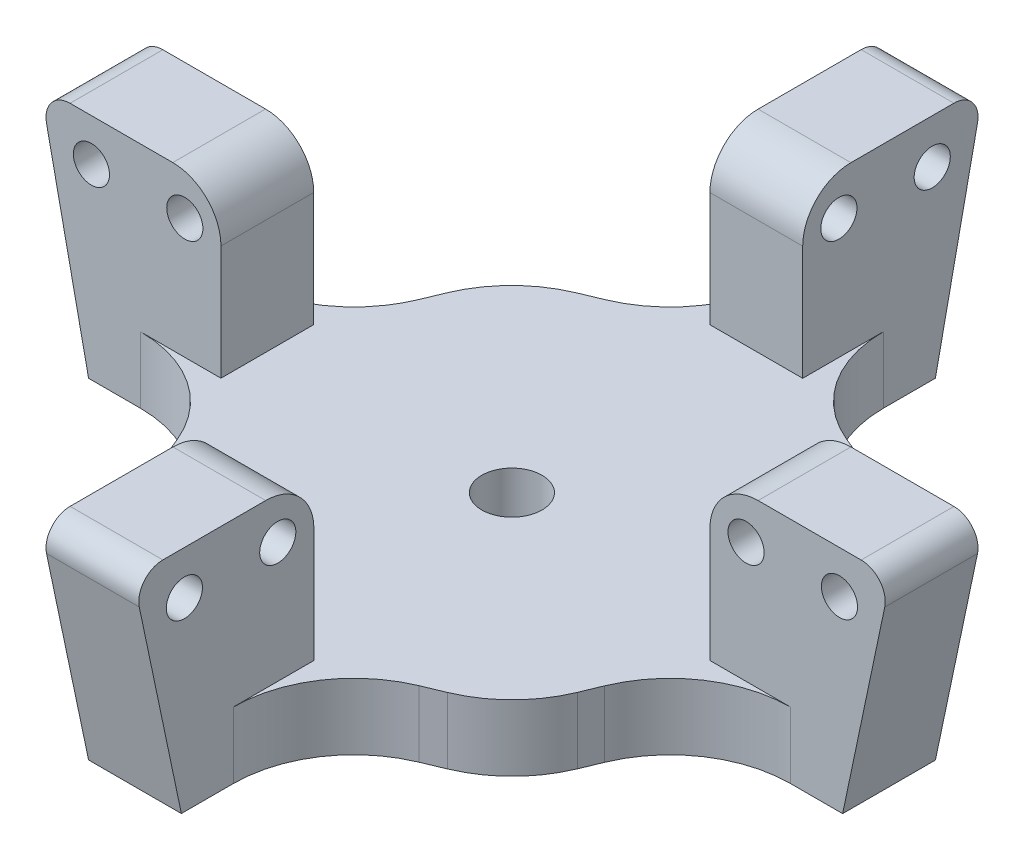
from build123d import *

# Parameters (mm, degrees)
BOSS_EXTRUSION_DEPTH     = 5.5
SCHIZZO2_W               = 14.985516936
SCHIZZO2_H               = 7.7
SCHIZZO2_W_2             = 7.7
SCHIZZO2_H_2             = 15.014483064
SCHIZZO2_W_3             = 15.014483064
SCHIZZO2_H_3             = 15
EXTERNAL_EXTRUSION_DEPTH = 13.5
SCHIZZO3_R               = 2.5
CETRAL_HOLE_DEPTH        = 52.71287379
TAGLIO_ESTRUSIONE2_DEPTH = 57.032066134
TAGLIO_ESTRUSIONE3_DEPTH = 57.021948056
TAGLIO_ESTRUSIONE4_DEPTH = 57.021948056
TAGLIO_ESTRUSIONE5_DEPTH = 57.032066134
FORO_PER_VITE_M4_1_D     = 3
FORO_PER_VITE_M4_2_D     = 3
FORO_PER_VITE_M4_3_D     = 3
FORO_PER_VITE_M4_4_D     = 3
RACCORDO1_R              = 4
RACCORDO2_R              = 4
RACCORDO3_R              = 4
RACCORDO4_R              = 4
RACCORDO5_R              = 2
RACCORDO6_R              = 2
RACCORDO7_R              = 2
RACCORDO8_R              = 2
RACCORDO9_R              = 10
RACCORDO17_R             = 10
RACCORDO18_R             = 10
RACCORDO19_R             = 10
RACCORDO20_R             = 10
RACCORDO21_R             = 10
RACCORDO22_DEPTH         = 5.5
RACCORDO23_R             = 10
RACCORDO24_R             = 10
RACCORDO25_R             = 10


with BuildPart() as part:
    # Schizzo1 → Boss extrusion (new body)
    with BuildSketch(Plane(origin=(0, 0, 0), x_dir=(1, 0, 0), z_dir=(0, 1, 0))):
        Polygon((-3.85, -20.28403897), (-3.85, -35.28403897), (3.85, -35.28403897), (3.85, -20.298522034), (15.500302101, -15.451094793), (20.28403897, -3.85), (35.298522034, -3.85), (35.298522034, 3.85), (20.298522034, 3.85), (15.451094793, 15.500302101), (3.85, 20.28403897), (3.85, 35.298522034), (-3.85, 35.298522034), (-3.85, 20.298522034), (-15.500302101, 15.451094793), (-20.28403897, 3.85), (-35.28403897, 3.85), (-35.28403897, -3.85), (-20.298522034, -3.85), (-15.451094793, -15.500302101), align=None)
    extrude(amount=BOSS_EXTRUSION_DEPTH)

    # Schizzo2 → external extrusion (add)
    with BuildSketch(Plane(origin=(0, 5.5, 0), x_dir=(1, 0, 0), z_dir=(0, 1, 0))):
        with Locations((-27.791280502, 0)):
            Rectangle(SCHIZZO2_W, SCHIZZO2_H)
        with Locations((0, 27.791280502)):
            Rectangle(SCHIZZO2_W_2, SCHIZZO2_H_2)
        with Locations((27.791280502, 0)):
            Rectangle(SCHIZZO2_W_3, SCHIZZO2_H)
        with Locations((0, -27.78403897)):
            Rectangle(SCHIZZO2_W_2, SCHIZZO2_H_3)
    extrude(amount=EXTERNAL_EXTRUSION_DEPTH)

    # Schizzo3 → cetral hole (cut, through all)
    with BuildSketch(Plane(origin=(0, 5.5, 0), x_dir=(1, 0, 0), z_dir=(0, 1, 0))):
        with Locations(Location((0, 0, 0), (0, 0, 270))):
            Circle(SCHIZZO3_R)
    extrude(amount=-CETRAL_HOLE_DEPTH, mode=Mode.SUBTRACT)

    # Schizzo4 → Taglio-Estrusione2 (cut, through all)
    with BuildSketch(Plane.XY.offset(3.85)):
        Polygon((35.298522034, 0), (35.298522034, 19), (31.298522034, 0), align=None)
    extrude(amount=-TAGLIO_ESTRUSIONE2_DEPTH, mode=Mode.SUBTRACT)

    # Schizzo5 → Taglio-Estrusione3 (cut, through all)
    with BuildSketch(Plane(origin=(3.85, 0, 0), x_dir=(0, 0, -1), z_dir=(1, 0, 0))):
        Polygon((35.298522034, 0), (35.298522034, 19), (31.298522034, 0), align=None)
    extrude(amount=-TAGLIO_ESTRUSIONE3_DEPTH, mode=Mode.SUBTRACT)

    # Schizzo8 → Taglio-Estrusione4 (cut, through all)
    with BuildSketch(Plane(origin=(0, 0, -3.85), x_dir=(-1, 0, 0), z_dir=(0, 0, -1))):
        Polygon((35.28403897, 0), (35.28403897, 19), (31.28403897, 0), align=None)
    extrude(amount=-TAGLIO_ESTRUSIONE4_DEPTH, mode=Mode.SUBTRACT)

    # Schizzo9 → Taglio-Estrusione5 (cut, through all)
    with BuildSketch(Plane.ZY.offset(3.85)):
        Polygon((35.28403897, 0), (35.28403897, 19), (31.28403897, 0), align=None)
    extrude(amount=-TAGLIO_ESTRUSIONE5_DEPTH, mode=Mode.SUBTRACT)

    # Foro per Vite M4-1 (through all)
    with Locations(Plane.ZY.offset(3.85)):
        with Locations((23.28403897, 15.5), (31.03403897, 15.381977535)):
            Hole(FORO_PER_VITE_M4_1_D / 2)

    # Foro per Vite M4-2 (through all)
    with Locations(Plane.XY.offset(3.85)):
        with Locations((23.28403897, 15.5), (31.03403897, 15.469257355)):
            Hole(FORO_PER_VITE_M4_2_D / 2)

    # Foro per Vite M4-3 (through all)
    with Locations(Plane(origin=(3.85, 0, 0), x_dir=(0, 0, -1), z_dir=(1, 0, 0))):
        with Locations((23.28403897, 15.5), (31.03403897, 15.315212004)):
            Hole(FORO_PER_VITE_M4_3_D / 2)

    # Foro per Vite M4-4 (through all)
    with Locations(Plane(origin=(0, 0, -3.85), x_dir=(-1, 0, 0), z_dir=(0, 0, -1))):
        with Locations((23.298522034, 15.5), (31.048522034, 15.5)):
            Hole(FORO_PER_VITE_M4_4_D / 2)

    # Raccordo1
    raccordo1_edges = [part.edges().sort_by_distance(p)[0] for p in [
        (20.28403897, 19, 0),
    ]]
    fillet(raccordo1_edges, radius=RACCORDO1_R)

    # Raccordo2
    raccordo2_edges = [part.edges().sort_by_distance(p)[0] for p in [
        (0, 19, -20.28403897),
    ]]
    fillet(raccordo2_edges, radius=RACCORDO2_R)

    # Raccordo3
    raccordo3_edges = [part.edges().sort_by_distance(p)[0] for p in [
        (-20.298522034, 19, 0),
    ]]
    fillet(raccordo3_edges, radius=RACCORDO3_R)

    # Raccordo4
    raccordo4_edges = [part.edges().sort_by_distance(p)[0] for p in [
        (0, 19, 20.28403897),
    ]]
    fillet(raccordo4_edges, radius=RACCORDO4_R)

    # Raccordo5
    raccordo5_edges = [part.edges().sort_by_distance(p)[0] for p in [
        (-35.28403897, 19, 0),
    ]]
    fillet(raccordo5_edges, radius=RACCORDO5_R)

    # Raccordo6
    raccordo6_edges = [part.edges().sort_by_distance(p)[0] for p in [
        (0, 19, -35.298522034),
    ]]
    fillet(raccordo6_edges, radius=RACCORDO6_R)

    # Raccordo7
    raccordo7_edges = [part.edges().sort_by_distance(p)[0] for p in [
        (35.298522034, 19, 0),
    ]]
    fillet(raccordo7_edges, radius=RACCORDO7_R)

    # Raccordo8
    raccordo8_edges = [part.edges().sort_by_distance(p)[0] for p in [
        (0, 19, 35.28403897),
    ]]
    fillet(raccordo8_edges, radius=RACCORDO8_R)

    # Raccordo9
    raccordo9_edges = [part.edges().sort_by_distance(p)[0] for p in [
        (3.85, 2.75, 20.298522034),
    ]]
    fillet(raccordo9_edges, radius=RACCORDO9_R)

    # Raccordo17
    raccordo17_edges = [part.edges().sort_by_distance(p)[0] for p in [
        (-3.85, 2.75, 20.28403897),
    ]]
    fillet(raccordo17_edges, radius=RACCORDO17_R)

    # Raccordo18
    raccordo18_edges = [part.edges().sort_by_distance(p)[0] for p in [
        (20.28403897, 2.75, 3.85),
    ]]
    fillet(raccordo18_edges, radius=RACCORDO18_R)

    # Raccordo19
    raccordo19_edges = [part.edges().sort_by_distance(p)[0] for p in [
        (20.298522034, 2.75, -3.85),
    ]]
    fillet(raccordo19_edges, radius=RACCORDO19_R)

    # Raccordo20
    raccordo20_edges = [part.edges().sort_by_distance(p)[0] for p in [
        (3.85, 2.75, -20.28403897),
    ]]
    fillet(raccordo20_edges, radius=RACCORDO20_R)

    # Raccordo21
    raccordo21_edges = [part.edges().sort_by_distance(p)[0] for p in [
        (-3.85, 2.75, -20.298522034),
    ]]
    fillet(raccordo21_edges, radius=RACCORDO21_R)

    # Raccordo22: read off the stored shape, not the designer's step
    # Raccordo22 outline → Raccordo22 (add)
    with BuildSketch(Plane(origin=(0, 0, 0), x_dir=(1, 0, 0), z_dir=(0, 1, 0))):
        with BuildLine():
            add(Edge.make_bspline(
                [(-26.977329566, 3.85), (-20.28403897, 3.85), (-17.732461927, 10.037858563)],
                knots=[0, 0, 0, 1, 1, 1], degree=2, weights=[1, 0.83102772, 1]))
            Line((-26.977329566, 3.85), (-20.28403897, 3.85))
            Line((-20.28403897, 3.85), (-17.732461927, 10.037858563))
        make_face()
    extrude(amount=RACCORDO22_DEPTH)

    # Raccordo23
    raccordo23_edges = [part.edges().sort_by_distance(p)[0] for p in [
        (-20.298522034, 2.75, 3.85),
    ]]
    fillet(raccordo23_edges, radius=RACCORDO23_R)

    # Raccordo24
    raccordo24_edges = [part.edges().sort_by_distance(p)[0] for p in [
        (-15.451094793, 2.75, 15.500302101),
    ]]
    fillet(raccordo24_edges, radius=RACCORDO24_R)

    # Raccordo25
    raccordo25_edges = [part.edges().sort_by_distance(p)[0] for p in [
        (-15.500302101, 2.75, -15.451094793),
        (15.451094793, 2.75, -15.500302101),
        (15.500302101, 2.75, 15.451094793),
    ]]
    fillet(raccordo25_edges, radius=RACCORDO25_R)


solid = part.part
